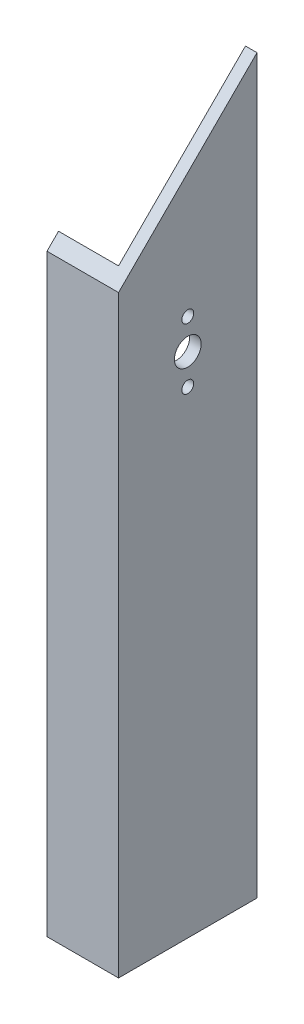
from build123d import *

# Parameters (mm, degrees)
BOSS_EXTRUDE1_DEPTH     = 203.2
CUT_EXTRUDE3_DEPTH      = 208.399204675
CUT_EXTRUDE3_DEPTH_BACK = 208.399204675
SKETCH7_R               = 3.683
SKETCH7_R_2             = 1.63195
CUT_EXTRUDE4_DEPTH      = 206.936716758


with BuildPart() as part:
    # Sketch1 → Boss-Extrude1 (new body)
    with BuildSketch(Plane(origin=(0, 0, 0), x_dir=(1, 0, 0), z_dir=(0, 1, 0))):
        Polygon((0, 0), (-19.685, 0), (-19.685, 3.175), (-3.175, 3.175), (-3.175, 38.1), (0, 38.1), align=None)
    extrude(amount=BOSS_EXTRUDE1_DEPTH)

    # Sketch5 → Cut-Extrude3 (cut, two sides: drawn at the far end of the back side and taken through both)
    with BuildSketch(Plane.ZY.offset(3.175).offset(-CUT_EXTRUDE3_DEPTH_BACK)):
        Polygon((0, 163.322), (-38.1, 201.422), (-60.823247691, 201.422), (-60.823247691, 256.047203652), (33.196571846, 256.047203652), (33.196571846, 163.322), align=None)
    extrude(amount=CUT_EXTRUDE3_DEPTH + CUT_EXTRUDE3_DEPTH_BACK, mode=Mode.SUBTRACT)

    # Sketch7 → Cut-Extrude4 (cut, through all)
    with BuildSketch(Plane(origin=(0, 0, 0), x_dir=(0, 0, -1), z_dir=(1, 0, 0))):
        with Locations((19.05, 139.7)):
            Circle(SKETCH7_R)
        with Locations((19.05, 148.082)):
            Circle(SKETCH7_R_2)
        with Locations((19.05, 131.318)):
            Circle(SKETCH7_R_2)
    extrude(amount=-CUT_EXTRUDE4_DEPTH, mode=Mode.SUBTRACT)


solid = part.part
